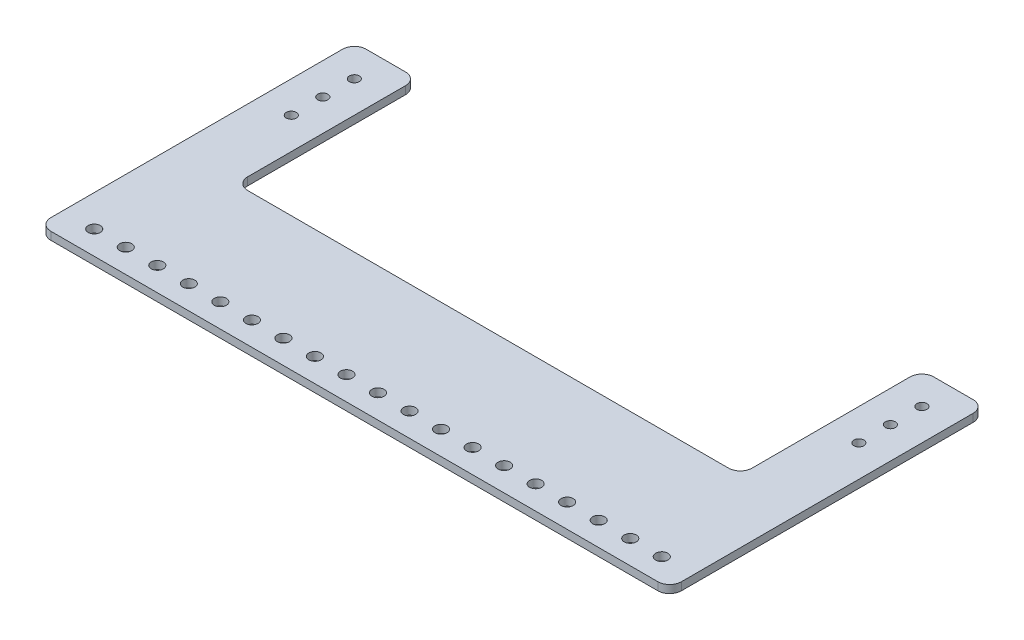
from build123d import *

# Parameters (mm, degrees)
SKETCH2_R           = 2.0193
BOSS_EXTRUDE1_DEPTH = 3.175
FILLET1_R           = 4.7625
SKETCH3_R           = 2.4384
CUT_EXTRUDE1_DEPTH  = 143.025809714


with BuildPart() as part:
    # Sketch2 → Boss-Extrude1 (new body)
    with BuildSketch(Plane(origin=(0, 0, 0), x_dir=(1, 0, 0), z_dir=(0, 1, 0))):
        Polygon((-127, 63.5), (-127, -63.5), (127, -63.5), (127, 63.5), (101.6, 63.5), (101.6, -9.652), (-101.6, -9.652), (-101.6, 63.5), align=None)
        with Locations((-114.3, 25.4)):
            Circle(SKETCH2_R, mode=Mode.SUBTRACT)
        with Locations((-114.3, 38.1)):
            Circle(SKETCH2_R, mode=Mode.SUBTRACT)
        with Locations((-114.3, 50.8)):
            Circle(SKETCH2_R, mode=Mode.SUBTRACT)
        with Locations((114.3, 25.4)):
            Circle(SKETCH2_R, mode=Mode.SUBTRACT)
        with Locations((114.3, 38.1)):
            Circle(SKETCH2_R, mode=Mode.SUBTRACT)
        with Locations((114.3, 50.8)):
            Circle(SKETCH2_R, mode=Mode.SUBTRACT)
    extrude(amount=BOSS_EXTRUDE1_DEPTH)

    # Fillet1
    fillet1_edges = [part.edges().sort_by_distance(p)[0] for p in [
        (127, 1.5875, -63.5),
        (-127, 1.5875, 63.5),
        (-127, 1.5875, -63.5),
        (-101.6, 1.5875, -63.5),
        (-101.6, 1.5875, 9.652),
        (101.6, 1.5875, 9.652),
        (101.6, 1.5875, -63.5),
        (127, 1.5875, 63.5),
    ]]
    fillet(fillet1_edges, radius=FILLET1_R)

    # Sketch3 → Cut-Extrude1 (cut, through all)
    with BuildSketch(Plane(origin=(0, 3.175, 0), x_dir=(1, 0, 0), z_dir=(0, 1, 0))):
        with Locations((-114.3, -53.975)):
            Circle(SKETCH3_R)
        with Locations((-101.6, -53.975)):
            Circle(SKETCH3_R)
        with Locations((-88.9, -53.975)):
            Circle(SKETCH3_R)
        with Locations((-76.2, -53.975)):
            Circle(SKETCH3_R)
        with Locations((-63.5, -53.975)):
            Circle(SKETCH3_R)
        with Locations((-50.8, -53.975)):
            Circle(SKETCH3_R)
        with Locations((-38.1, -53.975)):
            Circle(SKETCH3_R)
        with Locations((-25.4, -53.975)):
            Circle(SKETCH3_R)
        with Locations((-12.7, -53.975)):
            Circle(SKETCH3_R)
        with Locations((0, -53.975)):
            Circle(SKETCH3_R)
        with Locations((12.7, -53.975)):
            Circle(SKETCH3_R)
        with Locations((25.4, -53.975)):
            Circle(SKETCH3_R)
        with Locations((38.1, -53.975)):
            Circle(SKETCH3_R)
        with Locations((50.8, -53.975)):
            Circle(SKETCH3_R)
        with Locations((63.5, -53.975)):
            Circle(SKETCH3_R)
        with Locations((76.2, -53.975)):
            Circle(SKETCH3_R)
        with Locations((88.9, -53.975)):
            Circle(SKETCH3_R)
        with Locations((101.6, -53.975)):
            Circle(SKETCH3_R)
        with Locations((114.3, -53.975)):
            Circle(SKETCH3_R)
    extrude(amount=-CUT_EXTRUDE1_DEPTH, mode=Mode.SUBTRACT)


solid = part.part
